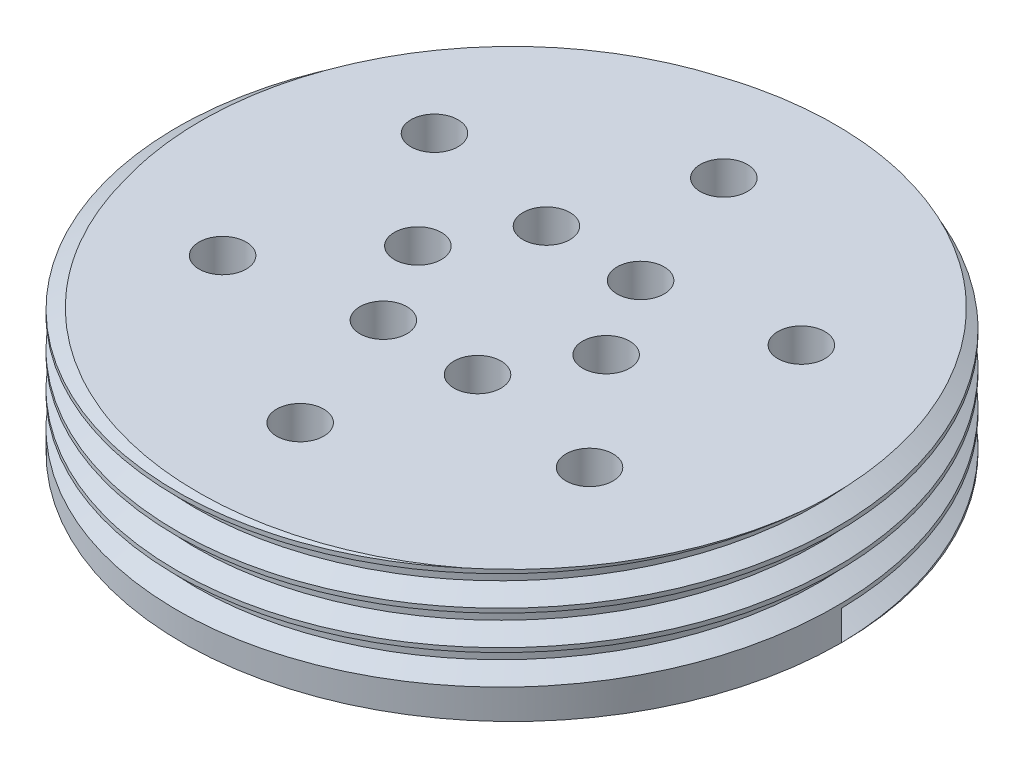
from build123d import *
from build123d.topology import SkipClean

# Parameters (mm, degrees)
SKETCH2_R           = 35
SKETCH2_R_2         = 2.5
BOSS_EXTRUDE1_DEPTH = 14
THREAD1_PITCH       = 3.628571429


with BuildPart() as part:
    # Sketch2 → Boss-Extrude1 (new body)
    with BuildSketch(Plane(origin=(0, 0, 0), x_dir=(1, 0, 0), z_dir=(0, 1, 0))):
        with Locations(Location((0, 0, 0), (0, 0, 270))):
            Circle(SKETCH2_R)
        with Locations(Location((0, 22.5, 0), (0, 0, 270))):
            Circle(SKETCH2_R_2, mode=Mode.SUBTRACT)
        with Locations(Location((19.485571585, 11.25, 0), (0, 0, 270))):
            Circle(SKETCH2_R_2, mode=Mode.SUBTRACT)
        with Locations(Location((19.485571585, -11.25, 0), (0, 0, 270))):
            Circle(SKETCH2_R_2, mode=Mode.SUBTRACT)
        with Locations(Location((0, -22.5, 0), (0, 0, 270))):
            Circle(SKETCH2_R_2, mode=Mode.SUBTRACT)
        with Locations(Location((-19.485571585, -11.25, 0), (0, 0, 270))):
            Circle(SKETCH2_R_2, mode=Mode.SUBTRACT)
        with Locations(Location((-19.485571585, 11.25, 0), (0, 0, 270))):
            Circle(SKETCH2_R_2, mode=Mode.SUBTRACT)
        with Locations(Location((-5, 8.660254038, 0), (0, 0, 270))):
            Circle(SKETCH2_R_2, mode=Mode.SUBTRACT)
        with Locations(Location((5, 8.660254038, 0), (0, 0, 270))):
            Circle(SKETCH2_R_2, mode=Mode.SUBTRACT)
        with Locations(Location((10, 0, 0), (0, 0, 270))):
            Circle(SKETCH2_R_2, mode=Mode.SUBTRACT)
        with Locations(Location((5, -8.660254038, 0), (0, 0, 270))):
            Circle(SKETCH2_R_2, mode=Mode.SUBTRACT)
        with Locations(Location((-5, -8.660254038, 0), (0, 0, 270))):
            Circle(SKETCH2_R_2, mode=Mode.SUBTRACT)
        with Locations(Location((-10, 0, 0), (0, 0, 270))):
            Circle(SKETCH2_R_2, mode=Mode.SUBTRACT)
    extrude(amount=BOSS_EXTRUDE1_DEPTH)

    # Thread1: the profile of Thread Profile1 profile screwed along a right-hand helix of 4.133858 turns, 12 arcs to a turn; built about Z, then put on its axis
    with SkipClean():  # the faces are left unmerged after this step: merging them gives an invalid solid
        thread1_z = Axis((0, 0, 0), (0, 0, 1))
        thread1_corners = [(35.0003, 0, -0.000173205), (35.0003, 0, 3.175173195), (33.035978111, 0, 2.041071424), (33.035978111, 0, 1.133928566)]
        with BuildLine(mode=Mode.PRIVATE) as thread1_profile:
            Line(thread1_corners[0], thread1_corners[1])
            Line(thread1_corners[1], thread1_corners[2])
            Line(thread1_corners[2], thread1_corners[3])
            Line(thread1_corners[3], thread1_corners[0])
        thread1_cap = Face(thread1_profile.wire())
        thread1_turn_angles = [0, 15, 30, 45, 60, 75, 90, 105, 120, 135, 150, 165, 180, 195, 210, 225, 240, 255, 270, 285, 300, 315, 330, 345, 360]
        thread1_turn_weights = [1, 0.9659258262890683, 1, 0.9659258262890683, 1, 0.9659258262890683, 1, 0.9659258262890683, 1, 0.9659258262890683, 1, 0.9659258262890683, 1, 0.9659258262890683, 1, 0.9659258262890683, 1, 0.9659258262890683, 1, 0.9659258262890683, 1, 0.9659258262890683, 1, 0.9659258262890683, 1]
        thread1_turn_rails = [Edge.make_bspline([Vector(p[0], p[1], 0).rotate(thread1_z, thread1_turn_angles[k]) / thread1_turn_weights[k] + Vector(0, 0, p[2] + THREAD1_PITCH * thread1_turn_angles[k] / 360) for k in range(25)], [0, 0, 0, 1, 1, 2, 2, 3, 3, 4, 4, 5, 5, 6, 6, 7, 7, 8, 8, 9, 9, 10, 10, 11, 11, 12, 12, 12], 2, thread1_turn_weights) for p in thread1_corners]
        thread1_turn_sides = [Face.make_surface_from_curves(thread1_turn_rails[p[0]], thread1_turn_rails[p[1]]) for p in [(0, 1), (1, 2), (2, 3), (3, 0)]]
        thread1_last_angles = [1440, 1455, 1470, 1479.094488189, 1488.188976378]
        thread1_last_weights = [1, 0.9659258262890683, 1, 0.9874290168694467, 1]
        thread1_last_rails = [Edge.make_bspline([Vector(p[0], p[1], 0).rotate(thread1_z, thread1_last_angles[k]) / thread1_last_weights[k] + Vector(0, 0, p[2] + THREAD1_PITCH * thread1_last_angles[k] / 360) for k in range(5)], [0, 0, 0, 1, 1, 2, 2, 2], 2, thread1_last_weights) for p in thread1_corners]
        thread1_last_sides = [Face.make_surface_from_curves(thread1_last_rails[p[0]], thread1_last_rails[p[1]]) for p in [(0, 1), (1, 2), (2, 3), (3, 0)]]
        thread1 = Plane(origin=(0, 0, 0), x_dir=(1, 0, 0), z_dir=(0, 1, 0)) * Solid(Shell([*[p.moved(Location((0, 0, THREAD1_PITCH * i))) for i in range(4) for p in thread1_turn_sides], *thread1_last_sides, thread1_cap, thread1_cap.rotate(thread1_z, 1488.188976378).moved(Location((0, 0, THREAD1_PITCH * 1488.188976378 / 360)))]))
        add(thread1, mode=Mode.SUBTRACT)


solid = part.part
